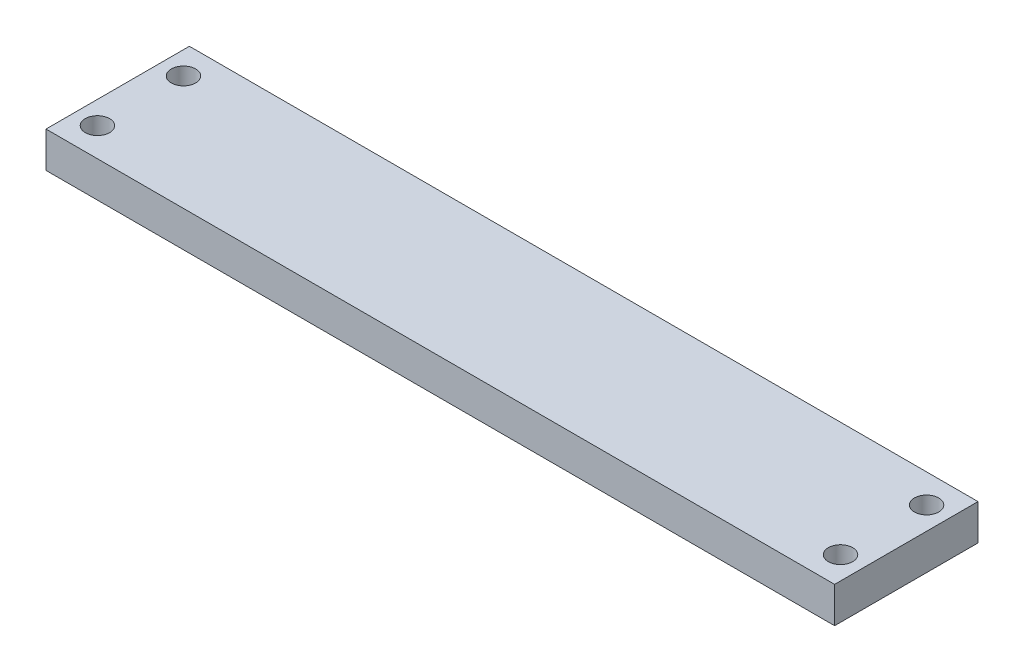
from build123d import *

# Parameters (mm, degrees)
SKETCH1_W            = 110
SKETCH1_H            = 20
BOSS_EXTRUDE1_DEPTH  = 2.5
M3_CLEARANCE_HOLE1_D = 3.4


with BuildPart() as part:
    # Sketch1 → Boss-Extrude1 (new, symmetric)
    with BuildSketch(Plane(origin=(0, 0, 0), x_dir=(1, 0, 0), z_dir=(0, 1, 0))):
        Rectangle(SKETCH1_W, SKETCH1_H)
    extrude(amount=BOSS_EXTRUDE1_DEPTH, both=True)

    # M3 Clearance Hole1 (through all)
    with Locations(Plane(origin=(0, 2.5, 0), x_dir=(1, 0, 0), z_dir=(0, 1, 0))):
        with Locations((51.825, 6), (-51.825, -6), (51.825, -6), (-51.825, 6)):
            Hole(M3_CLEARANCE_HOLE1_D / 2)


solid = part.part
